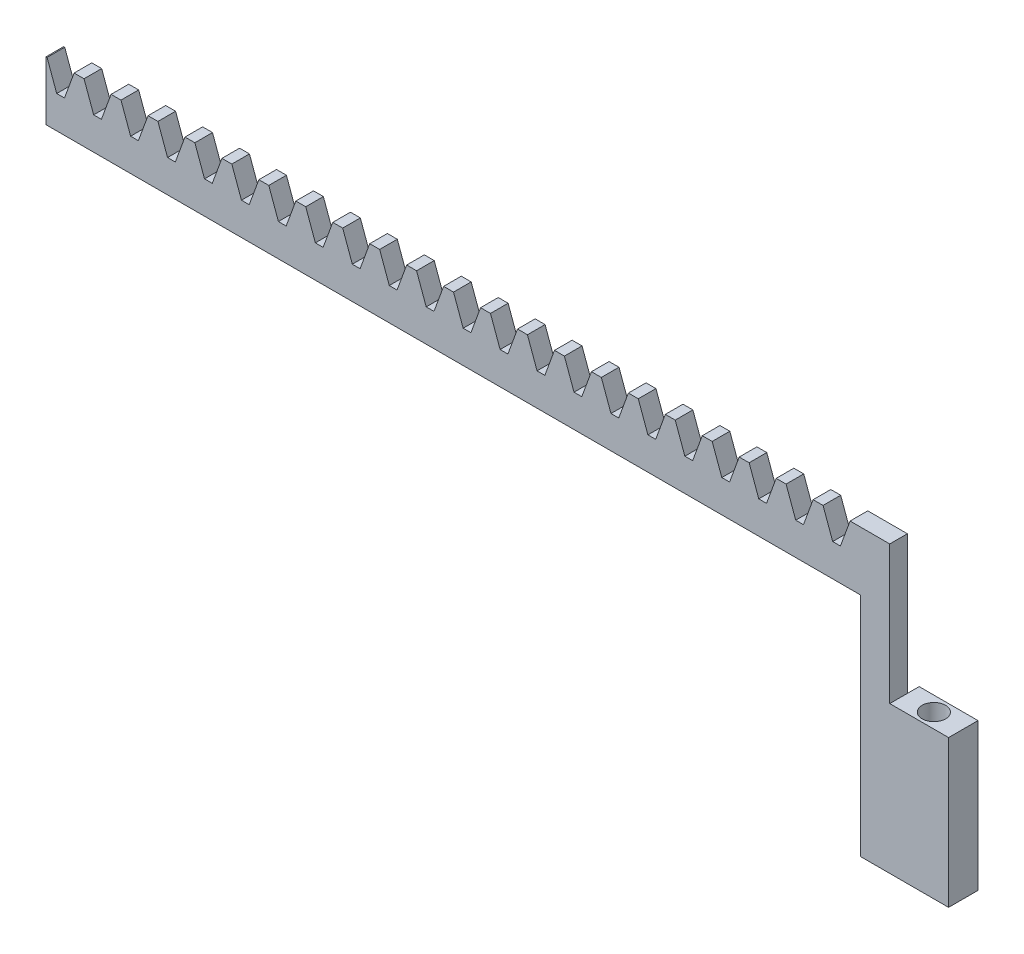
from build123d import *

# Parameters (mm, degrees)
SKETCH_1_W                 = 153.4
SKETCH_1_H                 = 10
EXTRUDE_1_DEPTH            = 3
CUT_EXTRUDE_1_DEPTH        = 78.407299397
PATTERN_LINEAR_1_COUNT     = 21
PATTERN_LINEAR_1_PITCH     = 6.28
PATTERN_LINEAR_1_COL_COUNT = 2
PATTERN_LINEAR_1_COL_PITCH = 6.28
SKETCH_3_W                 = 10
SKETCH_3_H                 = 3
CUT_EXTRUDE_2_DEPTH        = 78.407299397
SKETCH_4_W                 = 5
SKETCH_4_H                 = 3
EXTRUDE_2_DEPTH            = 38.5
EXTRUDE_START              = -5
EXTRUDE_1_2_OUTLINE_W      = 10
EXTRUDE_1_2_OUTLINE_H      = 25
EXTRUDE_1_2_DEPTH          = 5
SKETCH_6_R                 = 2
CUT_EXTRUDE_3_DEPTH        = 6
CUT_EXTRUDE_START          = -6
SKETCH_7_R                 = 2
CUT_EXTRUDE_4_DEPTH        = 6


# Read off the part's stored shape, not the designer's step: 돌출-얇게1
with BuildPart() as part:
    # 스케치1 → Extrude 1 (new body)
    with BuildSketch(Plane.XY):
        with Locations((0, 5)):
            Rectangle(SKETCH_1_W, SKETCH_1_H)
    extrude(amount=-EXTRUDE_1_DEPTH)

    # 스케치2 → 컷-돌출1 (cut, through all)
    with BuildSketch(Plane.XY):
        Polygon((-67.94, 8), (-67.94, 10), (-70.237940469, 10), (-69.51, 8), align=None)
        Polygon((-65.642059531, 10), (-67.94, 10), (-67.94, 8), (-66.37, 8), align=None)
        Polygon((-66.37, 8), (-67.94, 8), (-67.94, 5.5), (-67.279925586, 5.5), align=None)
        Polygon((-67.94, 5.5), (-67.94, 8), (-69.51, 8), (-68.600074414, 5.5), align=None)
    cut_extrude_1 = extrude(amount=-CUT_EXTRUDE_1_DEPTH, mode=Mode.SUBTRACT)

    # 선형 패턴1: 컷-돌출1 ×21
    with Locations(*[(i * PATTERN_LINEAR_1_PITCH, 0, 0) for i in range(1, PATTERN_LINEAR_1_COUNT)]):
        add(cut_extrude_1, mode=Mode.SUBTRACT)

    # 선형 패턴1 col: 컷-돌출1 ×2
    with Locations(*[(-i * PATTERN_LINEAR_1_COL_PITCH, 0, 0) for i in range(1, PATTERN_LINEAR_1_COL_COUNT)]):
        add(cut_extrude_1, mode=Mode.SUBTRACT)

    # 스케치3 → 컷-돌출2 (cut, through all)
    with BuildSketch(Plane.XZ):
        with Locations((71.7, -1.5)):
            Rectangle(SKETCH_3_W, SKETCH_3_H)
    extrude(amount=-CUT_EXTRUDE_2_DEPTH, mode=Mode.SUBTRACT)

    # 스케치4 → 보스-돌출2 (add)
    with BuildSketch(Plane(origin=(0, 0, 0), x_dir=(-1, 0, 0), z_dir=(0, -1, 0))):
        with Locations((-64.2, 1.5)):
            Rectangle(SKETCH_4_W, SKETCH_4_H)
    extrude(amount=EXTRUDE_2_DEPTH)

    # Extrude 1 2 outline → Extrude 1 2 (add)
    with BuildSketch(Plane.XY.offset(EXTRUDE_START)):
        with Locations((71.7, -26)):
            Rectangle(EXTRUDE_1_2_OUTLINE_W, EXTRUDE_1_2_OUTLINE_H)
    extrude(amount=EXTRUDE_1_2_DEPTH)

    # 스케치6 → 컷-돌출3 (cut)
    with BuildSketch(Plane(origin=(0, -38.5, 0), x_dir=(-1, 0, 0), z_dir=(0, -1, 0))):
        with Locations(Location((-71.7, 2.5, 0), (0, 0, 90))):
            Circle(SKETCH_6_R)
    extrude(amount=-CUT_EXTRUDE_3_DEPTH, mode=Mode.SUBTRACT)

    # 스케치7 → 컷-돌출4 (cut)
    with BuildSketch(Plane(origin=(0, -13.5, 0), x_dir=(1, 0, 0), z_dir=(0, 1, 0)).offset(CUT_EXTRUDE_START)):
        with Locations(Location((71.7, 2.5, 0), (0, 0, 90))):
            Circle(SKETCH_7_R)
    extrude(amount=CUT_EXTRUDE_4_DEPTH, mode=Mode.SUBTRACT)


solid = part.part
